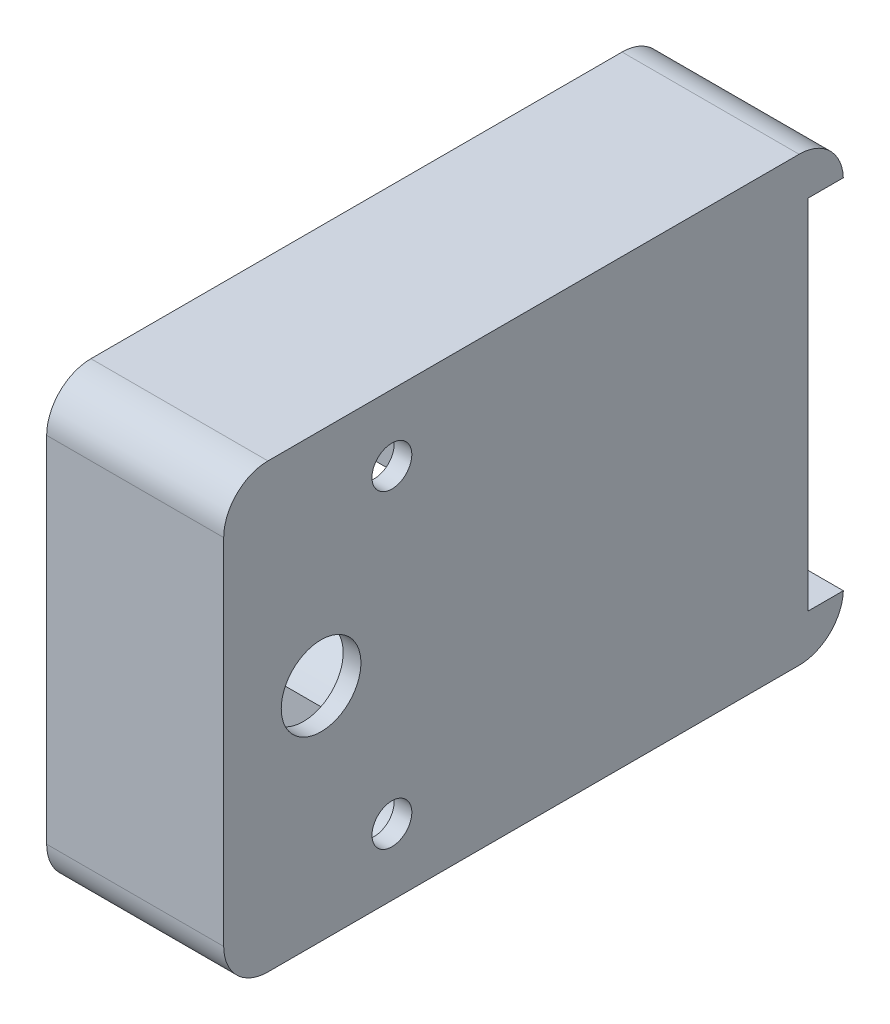
from build123d import *

# Parameters (mm, degrees)
SKETCH1_W           = 20
SKETCH1_H           = 50
BOSS_EXTRUDE1_DEPTH = 66
SKETCH2_R           = 4.9
BOSS_EXTRUDE2_DEPTH = 2
SKETCH3_R           = 2.4
BOSS_EXTRUDE3_DEPTH = 2
SKETCH4_R           = 1.5
CUT_EXTRUDE1_DEPTH  = 20
CUT_EXTRUDE2_START  = -18
CUT_EXTRUDE2_DEPTH  = 18
CUT_EXTRUDE3_REACH  = 86.735
SKETCH8_W           = 20
SKETCH8_H           = 4.8
BOSS_EXTRUDE4_DEPTH = 4
FILLET1_R           = 5


# Read off the part's stored shape, not the designer's step: Cut-Extrude2
with BuildPart() as part:
    # Sketch1 → Boss-Extrude1 (new body)
    with BuildSketch(Plane.XY):
        with Locations((10, 25)):
            Rectangle(SKETCH1_W, SKETCH1_H)
    extrude(amount=BOSS_EXTRUDE1_DEPTH)

    # Sketch2 → Boss-Extrude2 (add)
    with BuildSketch(Plane(origin=(0, 0, 0), x_dir=(-1, 0, 0), z_dir=(0, 0, -1))):
        with Locations((-10, 35)):
            Circle(SKETCH2_R)
        with Locations((-10, 15)):
            Circle(SKETCH2_R)
    extrude(amount=BOSS_EXTRUDE2_DEPTH)

    # Sketch3 → Boss-Extrude3 (add)
    with BuildSketch(Plane(origin=(0, 0, -2), x_dir=(-1, 0, 0), z_dir=(0, 0, -1))):
        with Locations((-10, 15)):
            Circle(SKETCH3_R)
        with Locations((-10, 35)):
            Circle(SKETCH3_R)
    extrude(amount=BOSS_EXTRUDE3_DEPTH)

    # Sketch4 → Cut-Extrude1 (cut)
    with BuildSketch(Plane(origin=(0, 0, -4), x_dir=(-1, 0, 0), z_dir=(0, 0, -1))):
        with Locations((-10, 15)):
            Circle(SKETCH4_R)
        with Locations((-10, 35)):
            Circle(SKETCH4_R)
    extrude(amount=-CUT_EXTRUDE1_DEPTH, mode=Mode.SUBTRACT)

    # Cut-Extrude2 outline → Cut-Extrude2 (cut)
    with BuildSketch(Plane.ZY.offset(CUT_EXTRUDE2_START)):
        with BuildLine():
            ThreePointArc((43.5, 38.555441712), (40.117469968, 37.191422409), (37.202041029, 35))
            Line((37.202041029, 35), (35.819660113, 35))
            ThreePointArc((35.819660113, 35), (34.783103517, 33.703300542), (33.896183762, 32.3))
            Line((33.896183762, 32.3), (31, 32.3))
            ThreePointArc((31, 32.3), (30.292893219, 32.007106781), (30, 31.3))
            Line((30, 31.3), (5, 31.3))
            Line((5, 31.3), (5, 18.7))
            Line((5, 18.7), (30, 18.7))
            ThreePointArc((30, 18.7), (30.292893219, 17.992893219), (31, 17.7))
            Line((31, 17.7), (33.896183762, 17.7))
            ThreePointArc((33.896183762, 17.7), (34.783103517, 16.296699458), (35.819660113, 15))
            Line((35.819660113, 15), (37.202041029, 15))
            ThreePointArc((37.202041029, 15), (40.117469968, 12.808577591), (43.5, 11.444558288))
            Line((43.5, 11.444558288), (43.5, 7.5))
            ThreePointArc((43.5, 7.5), (47, 4), (50.5, 7.5))
            Line((50.5, 7.5), (50.5, 11.444558288))
            ThreePointArc((50.5, 11.444558288), (61, 25), (50.5, 38.555441712))
            Line((50.5, 38.555441712), (50.5, 42.5))
            ThreePointArc((50.5, 42.5), (47, 46), (43.5, 42.5))
            Line((43.5, 42.5), (43.5, 38.555441712))
        make_face()
    extrude(amount=CUT_EXTRUDE2_DEPTH, mode=Mode.SUBTRACT)

    # Sketch7 → Cut-Extrude3 (cut, up to next)
    with BuildSketch(Plane.ZY.offset(-18), mode=Mode.PRIVATE) as cut_extrude3_sk1:
        with BuildLine():
            ThreePointArc((47, 40.25), (49.25, 42.5), (47, 44.75))
            ThreePointArc((47, 44.75), (44.75, 42.5), (47, 40.25))
        make_face()
    cut_extrude3_tool1 = extrude(cut_extrude3_sk1.sketch, amount=-CUT_EXTRUDE3_REACH, mode=Mode.PRIVATE) & part.part
    # Sketch7 → Cut-Extrude3 (cut, up to next)
    with BuildSketch(Plane.ZY.offset(-18), mode=Mode.PRIVATE) as cut_extrude3_sk2:
        with BuildLine():
            ThreePointArc((55, 20.5), (59.5, 25), (55, 29.5))
            ThreePointArc((55, 29.5), (50.5, 25), (55, 20.5))
        make_face()
    cut_extrude3_tool2 = extrude(cut_extrude3_sk2.sketch, amount=-CUT_EXTRUDE3_REACH, mode=Mode.PRIVATE) & part.part
    # Sketch7 → Cut-Extrude3 (cut, up to next)
    with BuildSketch(Plane.ZY.offset(-18), mode=Mode.PRIVATE) as cut_extrude3_sk3:
        with BuildLine():
            ThreePointArc((47, 5.25), (49.25, 7.5), (47, 9.75))
            ThreePointArc((47, 9.75), (44.75, 7.5), (47, 5.25))
        make_face()
    cut_extrude3_tool3 = extrude(cut_extrude3_sk3.sketch, amount=-CUT_EXTRUDE3_REACH, mode=Mode.PRIVATE) & part.part
    add(cut_extrude3_tool1.solids().sort_by_distance((18, 42.5, 47))[0], mode=Mode.SUBTRACT)
    add(cut_extrude3_tool2.solids().sort_by_distance((18, 25, 55))[0], mode=Mode.SUBTRACT)
    add(cut_extrude3_tool3.solids().sort_by_distance((18, 7.5, 47))[0], mode=Mode.SUBTRACT)

    # Sketch8 → Boss-Extrude4 (add)
    with BuildSketch(Plane(origin=(0, 0, 0), x_dir=(-1, 0, 0), z_dir=(0, 0, -1))):
        with Locations((-10, 2.4)):
            Rectangle(SKETCH8_W, SKETCH8_H)
        with Locations((-10, 47.6)):
            Rectangle(SKETCH8_W, SKETCH8_H)
    extrude(amount=BOSS_EXTRUDE4_DEPTH)

    # Fillet1
    # the kernel refuses this fillet: 5 mm, written as the material it takes off along each edge
    with BuildSketch(Plane(origin=(32.489995997, 0, -4), x_dir=(0, 0, 1), z_dir=(-1, 0, 0))) as fillet1_piece_1:
        with BuildLine():
            CenterArc((4.995998399, 5), FILLET1_R, 182.292442776, 87.707557224)
            Line((0, 4.8), (-0.099919968, 4.796))
            ThreePointArc((-0.099919968, 4.796), (-0.1, 2.4), (-0.1, 0))
            Line((-0.1, 0), (0, -0.1))
            Line((0, -0.1), (4.995998399, -0.1))
            Line((4.995998399, -0.1), (4.995998399, 0))
        make_face()
    extrude(amount=44.979991994, mode=Mode.SUBTRACT)
    with BuildSketch(Plane(origin=(32.489995997, 50, -4), x_dir=(0, -1, 0), z_dir=(-1, 0, 0))) as fillet1_piece_2:
        with BuildLine():
            CenterArc((5, 4.995998399), FILLET1_R, 180, 87.707557224)
            Line((0, 4.995998399), (-0.1, 4.995998399))
            Line((-0.1, 4.995998399), (-0.1, 0))
            Line((-0.1, 0), (0, -0.1))
            ThreePointArc((0, -0.1), (2.4, -0.1), (4.796, -0.099919968))
            Line((4.796, -0.099919968), (4.8, 0))
        make_face()
    extrude(amount=44.979991994, mode=Mode.SUBTRACT)
    with BuildSketch(Plane(origin=(32.5, 50, 66), x_dir=(0, 0, -1), z_dir=(-1, 0, 0)), Plane(origin=(-12.5, 0, 66), x_dir=(0, 0, -1), z_dir=(1, 0, 0))) as fillet1_piece_3:
        with BuildLine():
            CenterArc((FILLET1_R, FILLET1_R), FILLET1_R, 180, 90)
            Line((0, FILLET1_R), (-FILLET1_R * 0.02, FILLET1_R))
            Line((-FILLET1_R * 0.02, FILLET1_R), (-FILLET1_R * 0.02, -FILLET1_R * 0.02))
            Line((-FILLET1_R * 0.02, -FILLET1_R * 0.02), (FILLET1_R, -FILLET1_R * 0.02))
            Line((FILLET1_R, -FILLET1_R * 0.02), (FILLET1_R, 0))
        make_face()
    extrude(amount=45, mode=Mode.SUBTRACT)


solid = part.part
